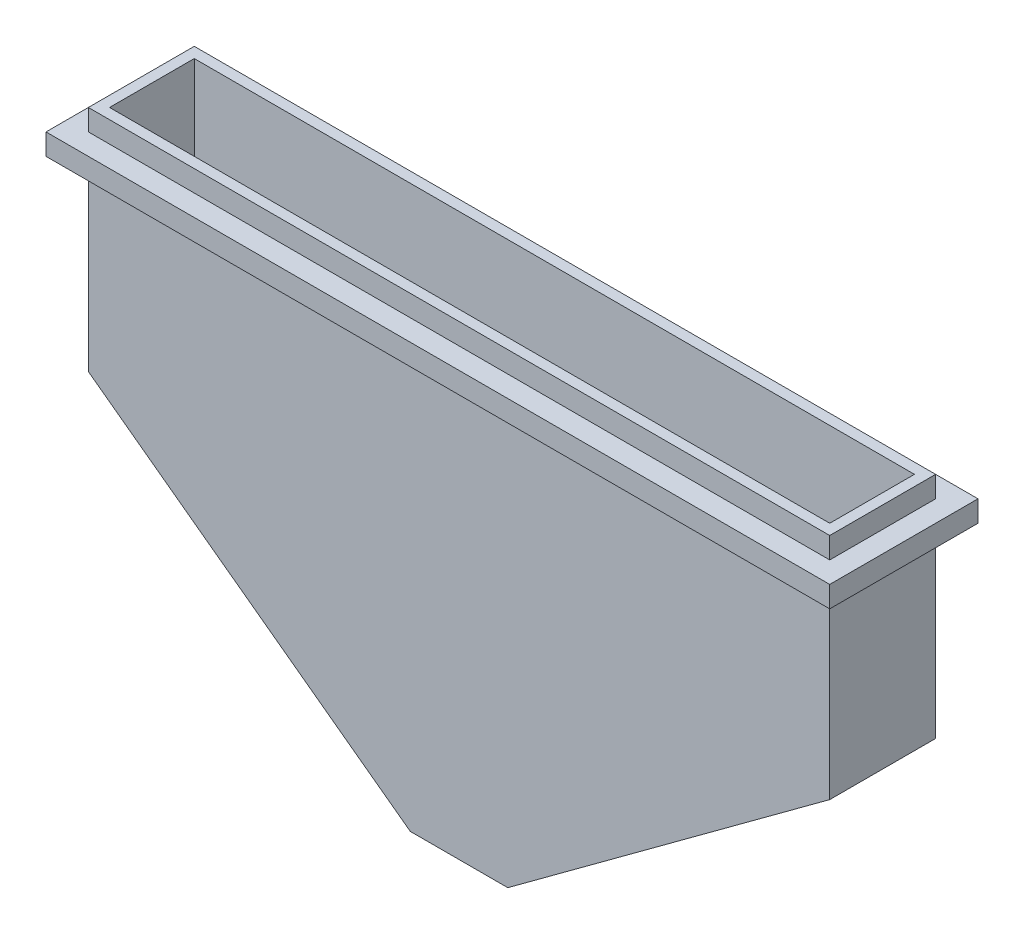
from build123d import *
from OCP.BRepFilletAPI import BRepFilletAPI_MakeChamfer

# Parameters (mm, degrees)
SKETCH_1_W          = 370
SKETCH_1_H          = 70
EXTRUDE_1_DEPTH     = 10
SKETCH_2_W          = 350
SKETCH_2_H          = 50
EXTRUDE_2_DEPTH     = 10
SKETCH_3_W          = 350
SKETCH_3_H          = 50
EXTRUDE_3_DEPTH     = 200
CHAMFER_1_SIZE      = 112
CHAMFER_1_SIZE2     = 152
SHELL_START         = -20
SHELL_1_DEPTH       = 40
SKETCH_4_R          = 12.5
CUT_EXTRUDE_1_DEPTH = 30


# Read off the part's stored shape, not the designer's step: 抽壳1
with BuildPart() as part:
    # 草图1 → 凸台-拉伸1 (new body)
    with BuildSketch(Plane(origin=(0, 0, 0), x_dir=(1, 0, 0), z_dir=(0, 1, 0))):
        Rectangle(SKETCH_1_W, SKETCH_1_H)
    extrude(amount=EXTRUDE_1_DEPTH)

    # 草图2 → 凸台-拉伸2 (add)
    with BuildSketch(Plane(origin=(0, 10, 0), x_dir=(1, 0, 0), z_dir=(0, 1, 0))):
        Rectangle(SKETCH_2_W, SKETCH_2_H)
    extrude(amount=EXTRUDE_2_DEPTH)

    # 草图3 → 凸台-拉伸3 (add)
    with BuildSketch(Plane.XZ):
        Rectangle(SKETCH_3_W, SKETCH_3_H)
    extrude(amount=EXTRUDE_3_DEPTH)

    # 倒角1: one chamfer whose edges measure the first distance from different faces: ONE call of the kernel's chamfer builder (chamfer() names one face for all edges)
    chamfer_1_edges_1 = [part.edges().sort_by_distance(p)[0] for p in [
        (-175, -200, 0),
    ]]
    chamfer_1_side_1 = [part.faces().sort_by_distance(p)[0] for p in [
        (-175, -100, 0),
    ]]
    chamfer_1_edges_2 = [part.edges().sort_by_distance(p)[0] for p in [
        (175, -200, 0),
    ]]
    chamfer_1_side_2 = [part.faces().sort_by_distance(p)[0] for p in [
        (175, -100, 0),
    ]]
    chamfer_1 = BRepFilletAPI_MakeChamfer(part.part.solid().wrapped)
    for e in chamfer_1_edges_1:
        chamfer_1.Add(CHAMFER_1_SIZE, CHAMFER_1_SIZE2, e.wrapped, chamfer_1_side_1[0].wrapped)  # the first distance lies on this face
    for e in chamfer_1_edges_2:
        chamfer_1.Add(CHAMFER_1_SIZE, CHAMFER_1_SIZE2, e.wrapped, chamfer_1_side_2[0].wrapped)  # the first distance lies on this face
    add(Compound.cast(chamfer_1.Shape()), mode=Mode.REPLACE)

    # 抽壳1 outline → 抽壳1 (cut)
    with BuildSketch(Plane.XY.offset(SHELL_START)):
        Polygon((170, -85.473461199), (170, 20), (-170, 20), (-170, -85.473461199), (-21.356840199, -195), (21.356840199, -195), align=None)
    extrude(amount=SHELL_1_DEPTH, mode=Mode.SUBTRACT)

    # 草图4 → 切除-拉伸1 (cut)
    with BuildSketch(Plane.XZ.offset(200)):
        with Locations(Location((0, 0, 0), (0, 0, 270))):
            Circle(SKETCH_4_R)
    extrude(amount=-CUT_EXTRUDE_1_DEPTH, mode=Mode.SUBTRACT)


solid = part.part
